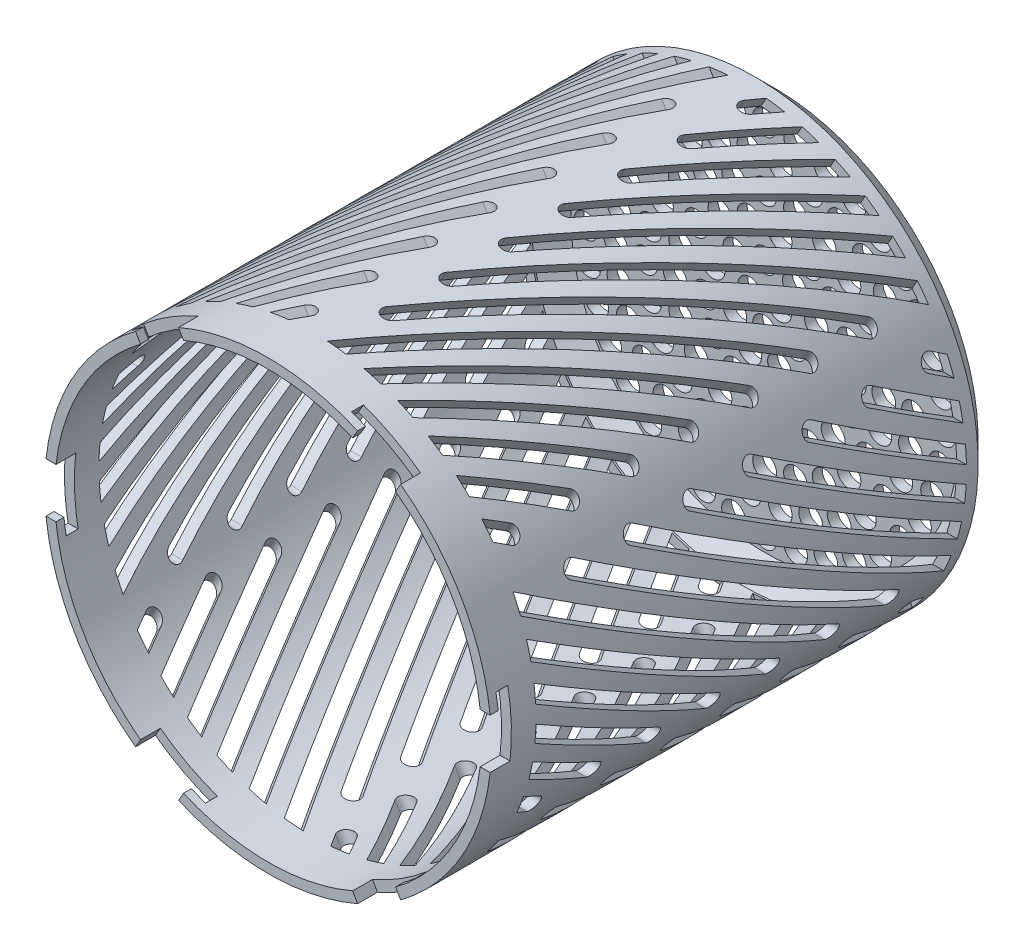
from build123d import *

# Parameters (mm, degrees)
SKETCH_1_R               = 22.5
SKETCH_1_R_2             = 21.5
EXTRUDE_1_DEPTH          = 50
EXTRUDE_START            = 1
SKETCH_2_R               = 22.5
EXTRUDE_2_DEPTH          = 1
CHAMFER_1_SIZE           = 2
SKETCH_3_R               = 1.2
CUT_EXTRUDE_1_DEPTH      = 12
SKETCH_4_W               = 54.58478755
SKETCH_4_H               = 5
CUT_EXTRUDE_2_DEPTH      = 2
CUT_EXTRUDE_3_DEPTH      = 5
PATTERN_CIRCULAR_1_COUNT = 6
SKETCH_6_W               = 4.963347198
SKETCH_6_H               = 3
CUT_EXTRUDE_4_DEPTH      = 1.2
PATTERN_CIRCULAR_2_COUNT = 6


with BuildPart() as part:
    # 草图1 → 凸台-拉伸1 (new body)
    with BuildSketch(Plane.XY):
        Circle(SKETCH_1_R)
        Circle(SKETCH_1_R_2, mode=Mode.SUBTRACT)
    extrude(amount=EXTRUDE_1_DEPTH)

    # 草图2 → 凸台-拉伸2 (add)
    with BuildSketch(Plane(origin=(0, 0, 0), x_dir=(-1, 0, 0), z_dir=(0, 0, -1)).offset(EXTRUDE_START)):
        Circle(SKETCH_2_R)
    extrude(amount=-EXTRUDE_2_DEPTH)

    # 倒角1
    chamfer_1_edges = [part.edges().sort_by_distance(p)[0] for p in [
        (22.5, 0, -1),
        (-21.5, 0, 0),
    ]]
    chamfer(chamfer_1_edges, length=CHAMFER_1_SIZE)

    # 草图3 → 切除-拉伸1 (cut)
    with BuildSketch(Plane(origin=(0, 0, -1), x_dir=(-1, 0, 0), z_dir=(0, 0, -1))):
        Circle(SKETCH_3_R)
        with Locations((3, 0)):
            Circle(SKETCH_3_R)
        with Locations((6, 0)):
            Circle(SKETCH_3_R)
        with Locations((9, 0)):
            Circle(SKETCH_3_R)
        with Locations((12, 0)):
            Circle(SKETCH_3_R)
        with Locations((15, 0)):
            Circle(SKETCH_3_R)
        with Locations((18, 0)):
            Circle(SKETCH_3_R)
        with Locations((1.5, -2.598076211)):
            Circle(SKETCH_3_R)
        with Locations((-1.5, -2.598076211)):
            Circle(SKETCH_3_R)
        with Locations((-3, 0)):
            Circle(SKETCH_3_R)
        with Locations((-1.5, 2.598076211)):
            Circle(SKETCH_3_R)
        with Locations((1.5, 2.598076211)):
            Circle(SKETCH_3_R)
        with Locations((5.196152423, -3)):
            Circle(SKETCH_3_R)
        with Locations((3, -5.196152423)):
            Circle(SKETCH_3_R)
        with Locations((0, -6)):
            Circle(SKETCH_3_R)
        with Locations((-3, -5.196152423)):
            Circle(SKETCH_3_R)
        with Locations((-5.196152423, -3)):
            Circle(SKETCH_3_R)
        with Locations((-6, 0)):
            Circle(SKETCH_3_R)
        with Locations((-5.196152423, 3)):
            Circle(SKETCH_3_R)
        with Locations((-3, 5.196152423)):
            Circle(SKETCH_3_R)
        with Locations((0, 6)):
            Circle(SKETCH_3_R)
        with Locations((3, 5.196152423)):
            Circle(SKETCH_3_R)
        with Locations((5.196152423, 3)):
            Circle(SKETCH_3_R)
        with Locations((8.457233587, -3.07818129)):
            Circle(SKETCH_3_R)
        with Locations((6.894399988, -5.785088487)):
            Circle(SKETCH_3_R)
        with Locations((4.5, -7.794228634)):
            Circle(SKETCH_3_R)
        with Locations((1.562833599, -8.863269777)):
            Circle(SKETCH_3_R)
        with Locations((-1.562833599, -8.863269777)):
            Circle(SKETCH_3_R)
        with Locations((-4.5, -7.794228634)):
            Circle(SKETCH_3_R)
        with Locations((-6.894399988, -5.785088487)):
            Circle(SKETCH_3_R)
        with Locations((-8.457233587, -3.07818129)):
            Circle(SKETCH_3_R)
        with Locations((-9, 0)):
            Circle(SKETCH_3_R)
        with Locations((-8.457233587, 3.07818129)):
            Circle(SKETCH_3_R)
        with Locations((-6.894399988, 5.785088487)):
            Circle(SKETCH_3_R)
        with Locations((-4.5, 7.794228634)):
            Circle(SKETCH_3_R)
        with Locations((-1.562833599, 8.863269777)):
            Circle(SKETCH_3_R)
        with Locations((1.562833599, 8.863269777)):
            Circle(SKETCH_3_R)
        with Locations((4.5, 7.794228634)):
            Circle(SKETCH_3_R)
        with Locations((6.894399988, 5.785088487)):
            Circle(SKETCH_3_R)
        with Locations((8.457233587, 3.07818129)):
            Circle(SKETCH_3_R)
        with Locations((11.591109915, -3.105828541)):
            Circle(SKETCH_3_R)
        with Locations((10.392304845, -6)):
            Circle(SKETCH_3_R)
        with Locations((8.485281374, -8.485281374)):
            Circle(SKETCH_3_R)
        with Locations((6, -10.392304845)):
            Circle(SKETCH_3_R)
        with Locations((3.105828541, -11.591109915)):
            Circle(SKETCH_3_R)
        with Locations((0, -12)):
            Circle(SKETCH_3_R)
        with Locations((-3.105828541, -11.591109915)):
            Circle(SKETCH_3_R)
        with Locations((-6, -10.392304845)):
            Circle(SKETCH_3_R)
        with Locations((-8.485281374, -8.485281374)):
            Circle(SKETCH_3_R)
        with Locations((-10.392304845, -6)):
            Circle(SKETCH_3_R)
        with Locations((-11.591109915, -3.105828541)):
            Circle(SKETCH_3_R)
        with Locations((-12, 0)):
            Circle(SKETCH_3_R)
        with Locations((-11.591109915, 3.105828541)):
            Circle(SKETCH_3_R)
        with Locations((-10.392304845, 6)):
            Circle(SKETCH_3_R)
        with Locations((-8.485281374, 8.485281374)):
            Circle(SKETCH_3_R)
        with Locations((-6, 10.392304845)):
            Circle(SKETCH_3_R)
        with Locations((-3.105828541, 11.591109915)):
            Circle(SKETCH_3_R)
        with Locations((0, 12)):
            Circle(SKETCH_3_R)
        with Locations((3.105828541, 11.591109915)):
            Circle(SKETCH_3_R)
        with Locations((6, 10.392304845)):
            Circle(SKETCH_3_R)
        with Locations((8.485281374, 8.485281374)):
            Circle(SKETCH_3_R)
        with Locations((10.392304845, 6)):
            Circle(SKETCH_3_R)
        with Locations((11.591109915, 3.105828541)):
            Circle(SKETCH_3_R)
        with Locations((14.672214011, -3.118675362)):
            Circle(SKETCH_3_R)
        with Locations((13.703181865, -6.101049646)):
            Circle(SKETCH_3_R)
        with Locations((12.135254916, -8.816778784)):
            Circle(SKETCH_3_R)
        with Locations((10.036959095, -11.147172382)):
            Circle(SKETCH_3_R)
        with Locations((7.5, -12.990381057)):
            Circle(SKETCH_3_R)
        with Locations((4.635254916, -14.265847744)):
            Circle(SKETCH_3_R)
        with Locations((1.567926949, -14.917828431)):
            Circle(SKETCH_3_R)
        with Locations((-1.567926949, -14.917828431)):
            Circle(SKETCH_3_R)
        with Locations((-4.635254916, -14.265847744)):
            Circle(SKETCH_3_R)
        with Locations((-7.5, -12.990381057)):
            Circle(SKETCH_3_R)
        with Locations((-10.036959095, -11.147172382)):
            Circle(SKETCH_3_R)
        with Locations((-12.135254916, -8.816778784)):
            Circle(SKETCH_3_R)
        with Locations((-13.703181865, -6.101049646)):
            Circle(SKETCH_3_R)
        with Locations((-14.672214011, -3.118675362)):
            Circle(SKETCH_3_R)
        with Locations((-15, 0)):
            Circle(SKETCH_3_R)
        with Locations((-14.672214011, 3.118675362)):
            Circle(SKETCH_3_R)
        with Locations((-13.703181865, 6.101049646)):
            Circle(SKETCH_3_R)
        with Locations((-12.135254916, 8.816778784)):
            Circle(SKETCH_3_R)
        with Locations((-10.036959095, 11.147172382)):
            Circle(SKETCH_3_R)
        with Locations((-7.5, 12.990381057)):
            Circle(SKETCH_3_R)
        with Locations((-4.635254916, 14.265847744)):
            Circle(SKETCH_3_R)
        with Locations((-1.567926949, 14.917828431)):
            Circle(SKETCH_3_R)
        with Locations((1.567926949, 14.917828431)):
            Circle(SKETCH_3_R)
        with Locations((4.635254916, 14.265847744)):
            Circle(SKETCH_3_R)
        with Locations((7.5, 12.990381057)):
            Circle(SKETCH_3_R)
        with Locations((10.036959095, 11.147172382)):
            Circle(SKETCH_3_R)
        with Locations((12.135254916, 8.816778784)):
            Circle(SKETCH_3_R)
        with Locations((13.703181865, 6.101049646)):
            Circle(SKETCH_3_R)
        with Locations((14.672214011, 3.118675362)):
            Circle(SKETCH_3_R)
        with Locations((17.726539554, -3.125667198)):
            Circle(SKETCH_3_R)
        with Locations((16.914467174, -6.15636258)):
            Circle(SKETCH_3_R)
        with Locations((15.588457268, -9)):
            Circle(SKETCH_3_R)
        with Locations((13.788799976, -11.570176974)):
            Circle(SKETCH_3_R)
        with Locations((11.570176974, -13.788799976)):
            Circle(SKETCH_3_R)
        with Locations((9, -15.588457268)):
            Circle(SKETCH_3_R)
        with Locations((6.15636258, -16.914467174)):
            Circle(SKETCH_3_R)
        with Locations((3.125667198, -17.726539554)):
            Circle(SKETCH_3_R)
        with Locations((0, -18)):
            Circle(SKETCH_3_R)
        with Locations((-3.125667198, -17.726539554)):
            Circle(SKETCH_3_R)
        with Locations((-6.15636258, -16.914467174)):
            Circle(SKETCH_3_R)
        with Locations((-9, -15.588457268)):
            Circle(SKETCH_3_R)
        with Locations((-11.570176974, -13.788799976)):
            Circle(SKETCH_3_R)
        with Locations((-13.788799976, -11.570176974)):
            Circle(SKETCH_3_R)
        with Locations((-15.588457268, -9)):
            Circle(SKETCH_3_R)
        with Locations((-16.914467174, -6.15636258)):
            Circle(SKETCH_3_R)
        with Locations((-17.726539554, -3.125667198)):
            Circle(SKETCH_3_R)
        with Locations((-18, 0)):
            Circle(SKETCH_3_R)
        with Locations((-17.726539554, 3.125667198)):
            Circle(SKETCH_3_R)
        with Locations((-16.914467174, 6.15636258)):
            Circle(SKETCH_3_R)
        with Locations((-15.588457268, 9)):
            Circle(SKETCH_3_R)
        with Locations((-13.788799976, 11.570176974)):
            Circle(SKETCH_3_R)
        with Locations((-11.570176974, 13.788799976)):
            Circle(SKETCH_3_R)
        with Locations((-9, 15.588457268)):
            Circle(SKETCH_3_R)
        with Locations((-6.15636258, 16.914467174)):
            Circle(SKETCH_3_R)
        with Locations((-3.125667198, 17.726539554)):
            Circle(SKETCH_3_R)
        with Locations((0, 18)):
            Circle(SKETCH_3_R)
        with Locations((3.125667198, 17.726539554)):
            Circle(SKETCH_3_R)
        with Locations((6.15636258, 16.914467174)):
            Circle(SKETCH_3_R)
        with Locations((9, 15.588457268)):
            Circle(SKETCH_3_R)
        with Locations((11.570176974, 13.788799976)):
            Circle(SKETCH_3_R)
        with Locations((13.788799976, 11.570176974)):
            Circle(SKETCH_3_R)
        with Locations((15.588457268, 9)):
            Circle(SKETCH_3_R)
        with Locations((16.914467174, 6.15636258)):
            Circle(SKETCH_3_R)
        with Locations((17.726539554, 3.125667198)):
            Circle(SKETCH_3_R)
    extrude(amount=-CUT_EXTRUDE_1_DEPTH, mode=Mode.SUBTRACT)

    # 草图4 → 切除-拉伸2 (cut)
    with BuildSketch(Plane.XY.offset(50)):
        Rectangle(SKETCH_4_W, SKETCH_4_H)
    cut_extrude_2 = extrude(amount=-CUT_EXTRUDE_2_DEPTH, mode=Mode.SUBTRACT)

    # 草图5 → 切除-拉伸3 (cut)
    with BuildSketch(Plane(origin=(-22.5, 0, 48), x_dir=(0, 0, 1), z_dir=(-1, 0, 0))):
        with BuildLine():
            Line((-2.472662905, 7.38614071), (-4.575961894, 8.600480947))
            ThreePointArc((-4.575961894, 8.600480947), (-4.850480947, 9.625), (-3.825961894, 9.899519053))
            Line((-3.825961894, 9.899519053), (-2.472662905, 9.118191517))
            Line((-2.472662905, 9.118191517), (-2.472662905, 7.38614071))
        make_face()
        with BuildLine():
            Line((-2.472662905, 5.654089902), (-9.825961894, 9.899519053))
            ThreePointArc((-9.825961894, 9.899519053), (-10.850480947, 9.625), (-10.575961894, 8.600480947))
            Line((-10.575961894, 8.600480947), (-2.472662905, 3.922039095))
            Line((-2.472662905, 3.922039095), (-2.472662905, 5.654089902))
        make_face()
        with BuildLine():
            Line((-45.825961894, 9.899519053), (-45.825961894, 8.167468245))
            Line((-45.825961894, 8.167468245), (-14.472662905, -9.934367366))
            ThreePointArc((-14.472662905, -9.934367366), (-13.448143853, -9.659848313), (-13.722662905, -8.63532926))
            Line((-13.722662905, -8.63532926), (-45.825961894, 9.899519053))
        make_face()
        with BuildLine():
            Line((-2.472662905, 2.189988287), (-15.825961894, 9.899519053))
            ThreePointArc((-15.825961894, 9.899519053), (-16.850480947, 9.625), (-16.575961894, 8.600480947))
            Line((-16.575961894, 8.600480947), (-2.472662905, 0.457937479))
            Line((-2.472662905, 0.457937479), (-2.472662905, 2.189988287))
        make_face()
        with BuildLine():
            Line((-2.472662905, -1.274113328), (-21.825961894, 9.899519053))
            ThreePointArc((-21.825961894, 9.899519053), (-22.850480947, 9.625), (-22.575961894, 8.600480947))
            Line((-22.575961894, 8.600480947), (-2.472662905, -3.006164136))
            Line((-2.472662905, -3.006164136), (-2.472662905, -1.274113328))
        make_face()
        with BuildLine():
            Line((-2.472662905, -4.738214943), (-27.825961894, 9.899519053))
            ThreePointArc((-27.825961894, 9.899519053), (-28.850480947, 9.625), (-28.575961894, 8.600480947))
            Line((-28.575961894, 8.600480947), (-2.472662905, -6.470265751))
            Line((-2.472662905, -6.470265751), (-2.472662905, -4.738214943))
        make_face()
        with BuildLine():
            Line((-2.472662905, -8.202316558), (-33.825961894, 9.899519053))
            ThreePointArc((-33.825961894, 9.899519053), (-34.850480947, 9.625), (-34.575961894, 8.600480947))
            Line((-34.575961894, 8.600480947), (-2.472662905, -9.934367366))
            Line((-2.472662905, -9.934367366), (-2.472662905, -8.202316558))
        make_face()
        with BuildLine():
            Line((-7.722662905, -8.63532926), (-39.825961894, 9.899519053))
            ThreePointArc((-39.825961894, 9.899519053), (-40.850480947, 9.625), (-40.575961894, 8.600480947))
            Line((-40.575961894, 8.600480947), (-8.472662905, -9.934367366))
            ThreePointArc((-8.472662905, -9.934367366), (-7.448143853, -9.659848313), (-7.722662905, -8.63532926))
        make_face()
        with BuildLine():
            Line((-19.722662905, -8.63532926), (-45.825961894, 6.435417438))
            Line((-45.825961894, 6.435417438), (-45.825961894, 4.70336663))
            Line((-45.825961894, 4.70336663), (-20.472662905, -9.934367366))
            ThreePointArc((-20.472662905, -9.934367366), (-19.448143853, -9.659848313), (-19.722662905, -8.63532926))
        make_face()
        with BuildLine():
            Line((-25.722662905, -8.63532926), (-45.825961894, 2.971315823))
            Line((-45.825961894, 2.971315823), (-45.825961894, 1.239265015))
            Line((-45.825961894, 1.239265015), (-26.472662905, -9.934367366))
            ThreePointArc((-26.472662905, -9.934367366), (-25.448143853, -9.659848313), (-25.722662905, -8.63532926))
        make_face()
        with BuildLine():
            Line((-31.722662905, -8.63532926), (-45.825961894, -0.492785793))
            Line((-45.825961894, -0.492785793), (-45.825961894, -2.2248366))
            Line((-45.825961894, -2.2248366), (-32.472662905, -9.934367366))
            ThreePointArc((-32.472662905, -9.934367366), (-31.448143853, -9.659848313), (-31.722662905, -8.63532926))
        make_face()
        with BuildLine():
            Line((-37.722662905, -8.63532926), (-45.825961894, -3.956887408))
            Line((-45.825961894, -3.956887408), (-45.825961894, -5.688938215))
            Line((-45.825961894, -5.688938215), (-38.472662905, -9.934367366))
            ThreePointArc((-38.472662905, -9.934367366), (-37.448143853, -9.659848313), (-37.722662905, -8.63532926))
        make_face()
        with BuildLine():
            Line((-43.722662905, -8.63532926), (-45.825961894, -7.420989023))
            Line((-45.825961894, -7.420989023), (-45.825961894, -9.15303983))
            Line((-45.825961894, -9.15303983), (-44.472662905, -9.934367366))
            ThreePointArc((-44.472662905, -9.934367366), (-43.448143853, -9.659848313), (-43.722662905, -8.63532926))
        make_face()
    cut_extrude_3 = extrude(amount=-CUT_EXTRUDE_3_DEPTH, mode=Mode.SUBTRACT)

    # 阵列(圆周)1: 切除-拉伸3 ×6 about axis
    pattern_circular_1_axis = Axis((0, 0, 0), (0, 0, 1))
    for i in range(1, PATTERN_CIRCULAR_1_COUNT):
        add(cut_extrude_3.rotate(pattern_circular_1_axis, i * 360 / PATTERN_CIRCULAR_1_COUNT), mode=Mode.SUBTRACT)

    # 草图6 → 切除-拉伸4 (cut)
    with BuildSketch(Plane.XY.offset(48)):
        with Locations((21.354156504, 2.5)):
            Rectangle(SKETCH_6_W, SKETCH_6_H)
    cut_extrude_4 = extrude(amount=CUT_EXTRUDE_4_DEPTH, mode=Mode.SUBTRACT)

    # 阵列(圆周)2: 切除-拉伸2, 切除-拉伸4 ×6 about axis
    pattern_circular_2_axis = Axis((0, 0, 0), (0, 0, 1))
    add([cut_extrude_2.rotate(pattern_circular_2_axis, i * 360 / PATTERN_CIRCULAR_2_COUNT) for i in range(1, PATTERN_CIRCULAR_2_COUNT)], mode=Mode.SUBTRACT)
    add([cut_extrude_4.rotate(pattern_circular_2_axis, i * 360 / PATTERN_CIRCULAR_2_COUNT) for i in range(1, PATTERN_CIRCULAR_2_COUNT)], mode=Mode.SUBTRACT)


solid = part.part
